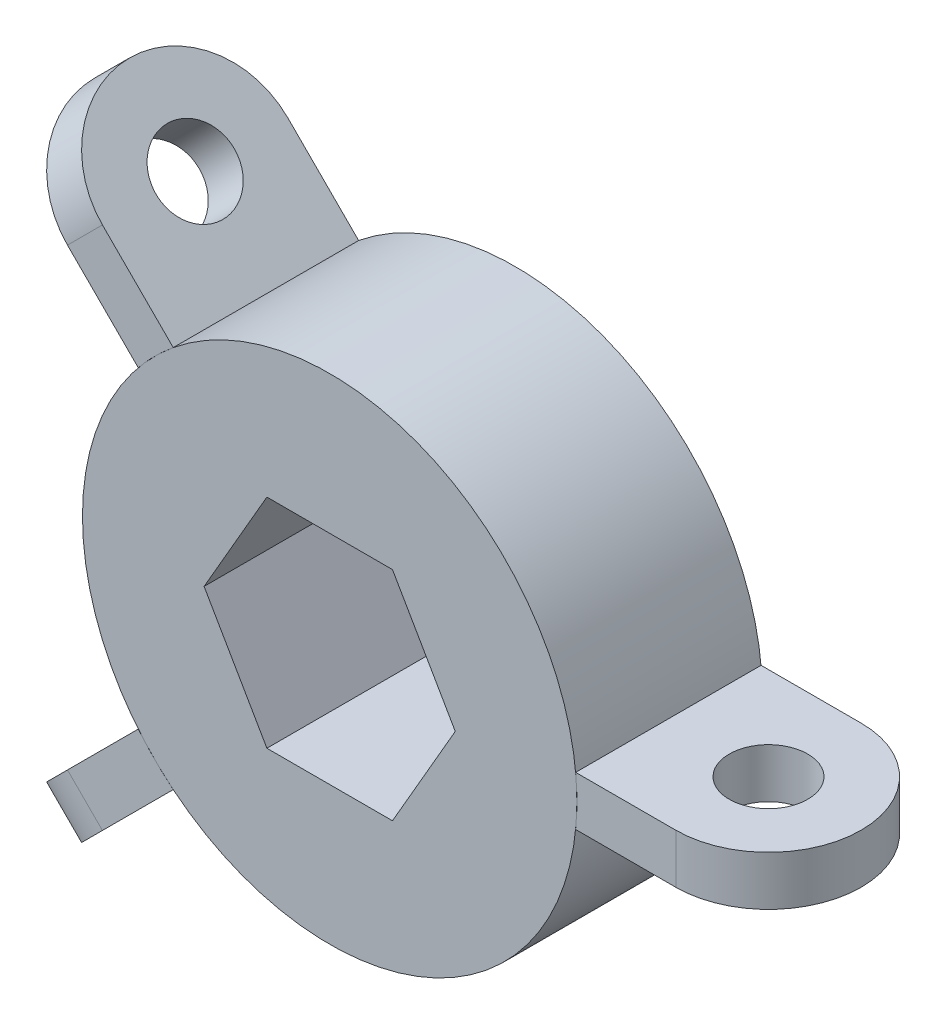
from build123d import *

# Parameters (mm, degrees)
SKETCH1_R                            = 20
SKETCH1_R_2                          = 2.5
BOSS_EXTRUDE1_DEPTH                  = 15
SKETCH5_W                            = 15
SKETCH5_H                            = 2
BOSS_EXTRUDE2_DEPTH                  = 8
BOSS_EXTRUDE2_DIRECTION_2_REACH      = 49.17
BOSS_EXTRUDE2_DIRECTION_2_END_RADIUS = 20
BOSS_EXTRUDE3_DEPTH                  = 4
SKETCH7_R                            = 3.175
CUT_EXTRUDE1_DEPTH                   = 4
CIRPATTERN2_ANGLE                    = 135
CIRPATTERN2_2_ANGLE                  = 135
CUT_EXTRUDE2_DEPTH                   = 15


with BuildPart() as part:
    # Sketch1 → Boss-Extrude1 (new body)
    with BuildSketch(Plane.XY):
        Circle(SKETCH1_R)
        Circle(SKETCH1_R_2, mode=Mode.SUBTRACT)
    extrude(amount=BOSS_EXTRUDE1_DEPTH)

    # Sketch8 → Cut-Extrude2 (cut)
    with BuildSketch(Plane(origin=(0, 0, 0), x_dir=(-1, 0, 0), z_dir=(0, 0, -1))):
        Polygon((-5.08, -8.798818102), (5.08, -8.798818102), (10.16, 0), (5.08, 8.798818102), (-5.08, 8.798818102), (-10.16, 0), align=None)
    extrude(amount=-CUT_EXTRUDE2_DEPTH, mode=Mode.SUBTRACT)


with BuildPart() as body_2:
    # Sketch5 → Boss-Extrude2 (new body)
    with BuildSketch(Plane(origin=(20, 0, 0), x_dir=(0, 0, -1), z_dir=(1, 0, 0))):
        with Locations((-7.5, 1)):
            Rectangle(SKETCH5_W, SKETCH5_H)
        with Locations((-7.5, -1)):
            Rectangle(SKETCH5_W, SKETCH5_H)
    extrude(amount=BOSS_EXTRUDE2_DEPTH)

    # Boss-Extrude2 direction 2: up to this cylinder (the profile starts outside it)
    boss_extrude2_direction_2_end = Plane(origin=(0, 0, 7.5), z_dir=(0, 0, -1)) * Cylinder(BOSS_EXTRUDE2_DIRECTION_2_END_RADIUS, 139.34, mode=Mode.PRIVATE)
    # Sketch5 → Boss-Extrude2 direction 2 (add, up to the surface)
    with BuildSketch(Plane(origin=(20, 0, 0), x_dir=(0, 0, -1), z_dir=(1, 0, 0)), mode=Mode.PRIVATE) as boss_extrude2_direction_2_sk1:
        with Locations((-7.5, 1)):
            Rectangle(SKETCH5_W, SKETCH5_H)
    boss_extrude2_direction_2_tool1 = extrude(boss_extrude2_direction_2_sk1.sketch, amount=-BOSS_EXTRUDE2_DIRECTION_2_REACH, mode=Mode.PRIVATE) - boss_extrude2_direction_2_end
    add(boss_extrude2_direction_2_tool1.solids().sort_by_distance((20, 1, 7.5))[0])
    # Sketch5 → Boss-Extrude2 direction 2 (add, up to the surface)
    with BuildSketch(Plane(origin=(20, 0, 0), x_dir=(0, 0, -1), z_dir=(1, 0, 0)), mode=Mode.PRIVATE) as boss_extrude2_direction_2_sk2:
        with Locations((-7.5, -1)):
            Rectangle(SKETCH5_W, SKETCH5_H)
    boss_extrude2_direction_2_tool2 = extrude(boss_extrude2_direction_2_sk2.sketch, amount=-BOSS_EXTRUDE2_DIRECTION_2_REACH, mode=Mode.PRIVATE) - boss_extrude2_direction_2_end
    add(boss_extrude2_direction_2_tool2.solids().sort_by_distance((20, -1, 7.5))[0])

    # Sketch6 → Boss-Extrude3 (add)
    with BuildSketch(Plane(origin=(0, -2, 0), x_dir=(-1, 0, 0), z_dir=(0, -1, 0))):
        with BuildLine():
            Line((-28, -15), (-28, 0))
            ThreePointArc((-28, 0), (-35.5, -7.5), (-28, -15))
        make_face()
    extrude(amount=-BOSS_EXTRUDE3_DEPTH)

    # Sketch7 → Cut-Extrude1 (cut)
    with BuildSketch(Plane(origin=(0, -2, 0), x_dir=(-1, 0, 0), z_dir=(0, -1, 0))):
        with Locations(Location((-28, -7.5, 0), (0, 0, 90))):
            Circle(SKETCH7_R)
    extrude(amount=-CUT_EXTRUDE1_DEPTH, mode=Mode.SUBTRACT)


with BuildPart() as body_3:
    # CirPattern2: read off the stored shape, not the designer's step
    # CirPattern2: copy of body 2
    add(body_2.part.rotate(Axis((0, 0, 0), (0, 0, 1)), CIRPATTERN2_ANGLE))


with BuildPart() as body_4:
    # CirPattern2 2: copy of body 2
    add(body_2.part.rotate(Axis((0, 0, 0), (0, 0, -1)), CIRPATTERN2_2_ANGLE))


solid = Compound([part.part, body_2.part, body_3.part, body_4.part])
